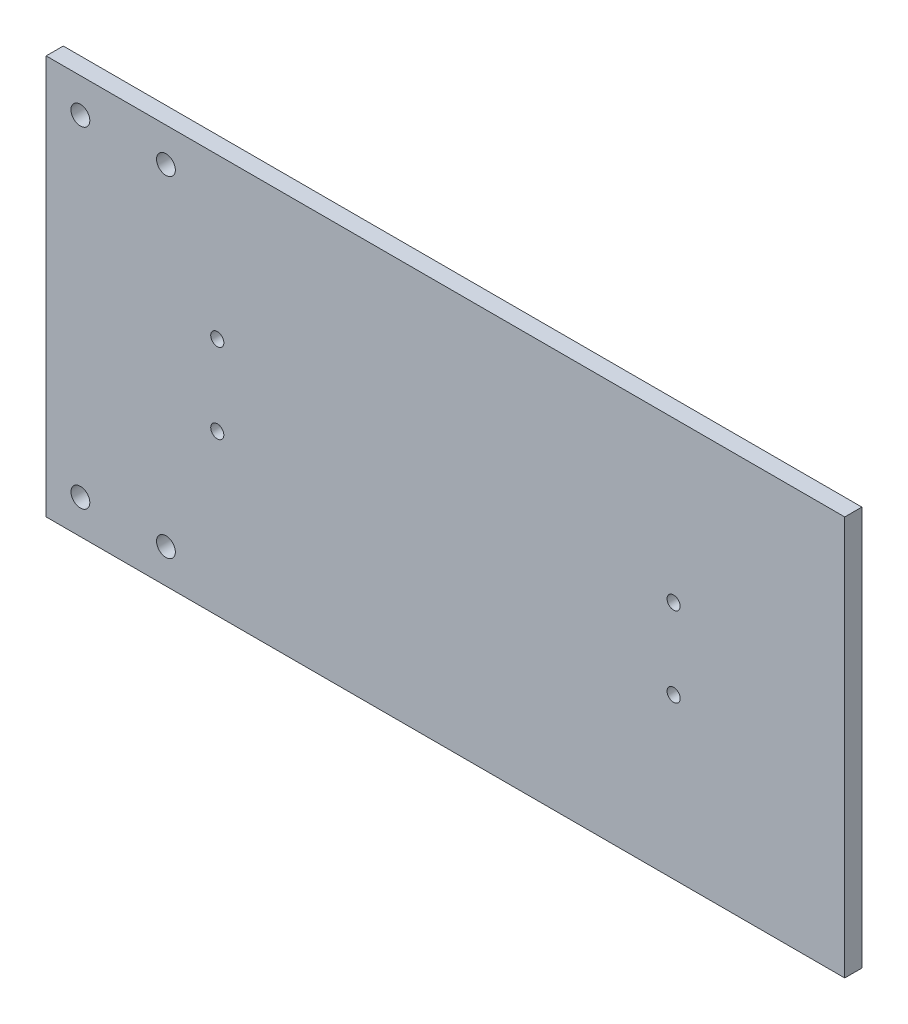
from build123d import *

# Parameters (mm, degrees)
SKETCH_1_W          = 140
SKETCH_1_H          = 70
EXTRUDE_1_DEPTH     = 3
SKETCH_2_R          = 1.65
CUT_EXTRUDE_1_DEPTH = 79.319856997
SKETCH_3_R          = 1.15
CUT_EXTRUDE_2_DEPTH = 79.319856997


with BuildPart() as part:
    # 草图1 → 凸台-拉伸1 (new body)
    with BuildSketch(Plane.XY):
        Rectangle(SKETCH_1_W, SKETCH_1_H)
    extrude(amount=EXTRUDE_1_DEPTH)

    # 草图2 → 切除-拉伸1 (cut, through all)
    with BuildSketch(Plane(origin=(0, 0, 0), x_dir=(-1, 0, 0), z_dir=(0, 0, -1))):
        with Locations((64, 29)):
            Circle(SKETCH_2_R)
        with Locations((64, -29)):
            Circle(SKETCH_2_R)
        with Locations((49, 29)):
            Circle(SKETCH_2_R)
        with Locations((49, -29)):
            Circle(SKETCH_2_R)
    extrude(amount=-CUT_EXTRUDE_1_DEPTH, mode=Mode.SUBTRACT)

    # 草图3 → 切除-拉伸2 (cut, through all)
    with BuildSketch(Plane(origin=(0, 0, 0), x_dir=(-1, 0, 0), z_dir=(0, 0, -1))):
        with Locations((-40, 7)):
            Circle(SKETCH_3_R)
        with Locations((-40, -7)):
            Circle(SKETCH_3_R)
        with Locations((40, 7)):
            Circle(SKETCH_3_R)
        with Locations((40, -7)):
            Circle(SKETCH_3_R)
    extrude(amount=-CUT_EXTRUDE_2_DEPTH, mode=Mode.SUBTRACT)


solid = part.part
